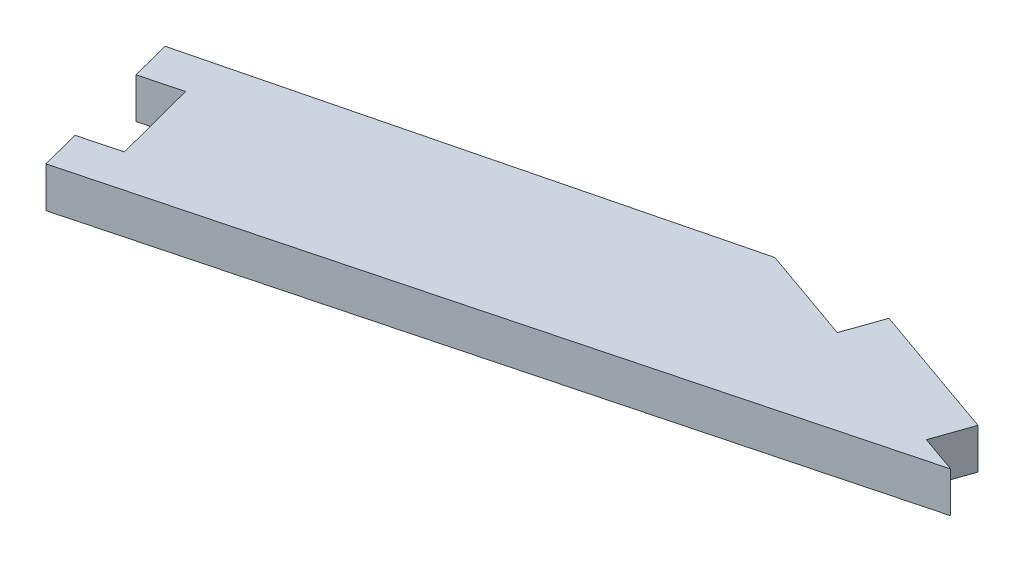
from build123d import *

# Parameters (mm, degrees)
BOSS_EXTRUDE1_DEPTH             = 15
BOSS_EXTRUDE2_REACH             = 1239.023
BOSS_EXTRUDE2_DIRECTION_2_REACH = 1239.023
CUT_EXTRUDE2_DEPTH              = 1238.578280352
CUT_EXTRUDE2_DEPTH_BACK         = 1238.578280352
SKETCH5_W                       = 40
SKETCH5_H                       = 40
CUT_EXTRUDE3_DEPTH              = 1238.578280352
BOSS_EXTRUDE4_DEPTH             = 75
CUT_EXTRUDE4_DEPTH              = 1241.107934819
CUT_EXTRUDE4_DEPTH_BACK         = 1241.107934819
SKETCH8_W                       = 15
SKETCH8_H                       = 73.7
FILLET1_R                       = 5
CUT_EXTRUDE5_DEPTH              = 1241.107934819
CUT_EXTRUDE5_DEPTH_BACK         = 1241.107934819
SKETCH9_W                       = 25
SKETCH9_H                       = 15
SKETCH9_W_2                     = 15
CUT_EXTRUDE6_DEPTH              = 1241.107934819
CUT_EXTRUDE6_DEPTH_BACK         = 1241.107934819
SKETCH10_W                      = 1728.920732784
SKETCH10_H                      = 178.853868908
SKETCH10_W_2                    = 1650
SKETCH10_H_2                    = 15
SKETCH11_W                      = 1852.680615207
SKETCH11_H                      = 1075.927112831
CUT_EXTRUDE7_DEPTH              = 1238.022635201


with BuildPart() as part:
    # Sketch1 → Boss-Extrude1 (new body)
    with BuildSketch(Plane(origin=(0, 0, 0), x_dir=(1, 0, 0), z_dir=(0, 1, 0))):
        Polygon((-450, 300), (-400, 300), (-200, 250), (600, 40), (1200, 40), (1200, -40), (600, -40), (-200, -250), (-400, -300), (-450, -300), align=None)
    extrude(amount=BOSS_EXTRUDE1_DEPTH)

    # Boss-Extrude2: up to this face of the body (flat: up to its plane)
    boss_extrude2_end = Plane(part.part.faces().sort_by_distance((-425, 7.5, 300))[0])
    # Sketch2 → Boss-Extrude2 (add, up to the picked face)
    with BuildSketch(Plane.XY, mode=Mode.PRIVATE) as boss_extrude2_sk1:
        with BuildLine():
            Line((-425, 0), (-450, 0))
            Line((-450, 0), (-450, -40))
            Line((-450, -40), (-440, -40))
            Line((-440, -40), (-440, -15))
            ThreePointArc((-440, -15), (-435.606601718, -4.393398282), (-425, 0))
        make_face()
    boss_extrude2_tool1 = split(extrude(boss_extrude2_sk1.sketch, amount=BOSS_EXTRUDE2_REACH, mode=Mode.PRIVATE), bisect_by=boss_extrude2_end, keep=Keep.BOTH, mode=Mode.PRIVATE)
    # Sketch2 → Boss-Extrude2 (add, up to the picked face)
    with BuildSketch(Plane.XY, mode=Mode.PRIVATE) as boss_extrude2_sk2:
        with BuildLine():
            Line((-400, 0), (-425, 0))
            ThreePointArc((-425, 0), (-414.393398282, -4.393398282), (-410, -15))
            Line((-410, -15), (-410, -40))
            Line((-410, -40), (-400, -40))
            Line((-400, -40), (-400, 0))
        make_face()
    boss_extrude2_tool2 = split(extrude(boss_extrude2_sk2.sketch, amount=BOSS_EXTRUDE2_REACH, mode=Mode.PRIVATE), bisect_by=boss_extrude2_end, keep=Keep.BOTH, mode=Mode.PRIVATE)
    add(boss_extrude2_tool1.solids().sort_by(Axis((-444.100555, -18.206662, 0), (0, 0, 1)))[0])
    add(boss_extrude2_tool2.solids().sort_by(Axis((-405.899445, -18.206662, 0), (0, 0, 1)))[0])

    # Boss-Extrude2 direction 2: up to this face of the body (flat: up to its plane)
    boss_extrude2_direction_2_end = Plane(part.part.faces().sort_by_distance((-425, 7.5, -300))[0])
    # Sketch2 → Boss-Extrude2 direction 2 (add, up to the picked face)
    with BuildSketch(Plane.XY, mode=Mode.PRIVATE) as boss_extrude2_direction_2_sk1:
        with BuildLine():
            Line((-425, 0), (-450, 0))
            Line((-450, 0), (-450, -40))
            Line((-450, -40), (-440, -40))
            Line((-440, -40), (-440, -15))
            ThreePointArc((-440, -15), (-435.606601718, -4.393398282), (-425, 0))
        make_face()
    boss_extrude2_direction_2_tool1 = split(extrude(boss_extrude2_direction_2_sk1.sketch, amount=-BOSS_EXTRUDE2_DIRECTION_2_REACH, mode=Mode.PRIVATE), bisect_by=boss_extrude2_direction_2_end, keep=Keep.BOTH, mode=Mode.PRIVATE)
    # Sketch2 → Boss-Extrude2 direction 2 (add, up to the picked face)
    with BuildSketch(Plane.XY, mode=Mode.PRIVATE) as boss_extrude2_direction_2_sk2:
        with BuildLine():
            Line((-400, 0), (-425, 0))
            ThreePointArc((-425, 0), (-414.393398282, -4.393398282), (-410, -15))
            Line((-410, -15), (-410, -40))
            Line((-410, -40), (-400, -40))
            Line((-400, -40), (-400, 0))
        make_face()
    boss_extrude2_direction_2_tool2 = split(extrude(boss_extrude2_direction_2_sk2.sketch, amount=-BOSS_EXTRUDE2_DIRECTION_2_REACH, mode=Mode.PRIVATE), bisect_by=boss_extrude2_direction_2_end, keep=Keep.BOTH, mode=Mode.PRIVATE)
    add(boss_extrude2_direction_2_tool1.solids().sort_by(Axis((-444.100555, -18.206662, 0), (0, 0, -1)))[0])
    add(boss_extrude2_direction_2_tool2.solids().sort_by(Axis((-405.899445, -18.206662, 0), (0, 0, -1)))[0])

    # Sketch4 → Cut-Extrude2 (cut, two sides: drawn at the far end of the back side and taken through both)
    with BuildSketch(Plane(origin=(0, 0, 0), x_dir=(1, 0, 0), z_dir=(0, 1, 0)).offset(-CUT_EXTRUDE2_DEPTH_BACK)):
        Polygon((-450, 230), (-400, 230), (-150, 167.5), (-150, -167.5), (-400, -230), (-450, -230), align=None)
        Polygon((-100, 155), (-100, -155), (520, 0), align=None)
    extrude(amount=CUT_EXTRUDE2_DEPTH + CUT_EXTRUDE2_DEPTH_BACK, mode=Mode.SUBTRACT)

    # Sketch5 → Cut-Extrude3 (cut, through all)
    with BuildSketch(Plane(origin=(0, 0, 0), x_dir=(0, 0, -1), z_dir=(1, 0, 0))):
        with Locations((-265, -20)):
            Rectangle(SKETCH5_W, SKETCH5_H)
        with Locations((265, -20)):
            Rectangle(SKETCH5_W, SKETCH5_H)
    extrude(amount=-CUT_EXTRUDE3_DEPTH, mode=Mode.SUBTRACT)

    # Sketch7 → Boss-Extrude4 (add)
    with BuildSketch(Plane(origin=(1200, 0, 0), x_dir=(0, 0, -1), z_dir=(1, 0, 0))):
        with BuildLine():
            Line((-87.5, 50), (-40, 15))
            Line((-40, 15), (40, 15))
            Line((40, 15), (87.5, 50))
            Line((87.5, 50), (87.5, 88.7))
            Line((87.5, 88.7), (58.5, 88.7))
            Line((58.5, 88.7), (58.5, 63.2))
            Line((58.5, 63.2), (48.5, 63.2))
            Line((48.5, 63.2), (48.5, 88.7))
            Line((48.5, 88.7), (20, 88.7))
            Line((20, 88.7), (20, 50))
            ThreePointArc((20, 50), (0, 30), (-20, 50))
            Line((-20, 50), (-20, 88.7))
            Line((-20, 88.7), (-63, 88.7))
            Line((-63, 88.7), (-63, 63.2))
            Line((-63, 63.2), (-73, 63.2))
            Line((-73, 63.2), (-73, 88.7))
            Line((-73, 88.7), (-87.5, 88.7))
            Line((-87.5, 88.7), (-87.5, 50))
        make_face()
    extrude(amount=-BOSS_EXTRUDE4_DEPTH)

    # Sketch8 → Cut-Extrude4 (cut, two sides: drawn at the far end of the back side and taken through both)
    with BuildSketch(Plane.XY.offset(-CUT_EXTRUDE4_DEPTH_BACK)):
        with Locations((1147.5, 51.85)):
            Rectangle(SKETCH8_W, SKETCH8_H)
        with Locations((1177.5, 51.85)):
            Rectangle(SKETCH8_W, SKETCH8_H)
    extrude(amount=CUT_EXTRUDE4_DEPTH + CUT_EXTRUDE4_DEPTH_BACK, mode=Mode.SUBTRACT)

    # Fillet1
    fillet1_edges = [part.edges().sort_by_distance(p)[0] for p in [
        (1192.5, 50, 87.5),
        (1162.5, 50, 87.5),
        (1132.5, 50, 87.5),
        (1192.5, 50, -87.5),
        (1162.5, 50, -87.5),
        (1132.5, 50, -87.5),
        (1192.5, 88.7, -87.5),
        (1162.5, 88.7, -87.5),
        (1132.5, 88.7, -87.5),
        (1132.5, 88.7, -58.5),
        (1162.5, 88.7, -58.5),
        (1192.5, 88.7, -58.5),
        (1192.5, 88.7, -48.5),
        (1162.5, 88.7, -48.5),
        (1132.5, 88.7, -48.5),
        (1192.5, 88.7, -20),
        (1162.5, 88.7, -20),
        (1132.5, 88.7, -20),
        (1192.5, 88.7, 63),
        (1162.5, 88.7, 63),
        (1132.5, 88.7, 63),
        (1132.5, 88.7, 87.5),
        (1162.5, 88.7, 87.5),
        (1192.5, 88.7, 87.5),
        (1192.5, 88.7, 73),
        (1162.5, 88.7, 73),
        (1132.5, 88.7, 73),
        (1192.5, 88.7, 20),
        (1162.5, 88.7, 20),
        (1132.5, 88.7, 20),
        (600, 7.5, 40),
        (600, 7.5, -40),
        (520, 7.5, 0),
        (-440, -40, -292.5),
        (-440, -40, -237.5),
        (-400, -40, -292.5),
        (-400, -40, -237.5),
        (-450, -40, -237.5),
        (-410, -40, -237.5),
        (-450, -40, -292.5),
        (-410, -40, -292.5),
        (-150, 7.5, 167.5),
        (-100, 7.5, 155),
        (-150, 7.5, -167.5),
        (-100, 7.5, -155),
        (-450, -40, 237.5),
        (-410, -40, 237.5),
        (-440, -40, 237.5),
        (-400, -40, 237.5),
        (-450, -40, 292.5),
        (-440, -40, 292.5),
        (-400, -40, 292.5),
        (-410, -40, 292.5),
    ]]
    fillet(fillet1_edges, radius=FILLET1_R - 0.0001)  # a hair under: the kernel refuses the full size

    # Sketch9 → Cut-Extrude5 (cut, two sides: drawn at the far end of the back side and taken through both)
    with BuildSketch(Plane(origin=(0, 0, 0), x_dir=(1, 0, 0), z_dir=(0, 1, 0)).offset(-CUT_EXTRUDE5_DEPTH_BACK)):
        with Locations((-425, -292.5)):
            Rectangle(SKETCH9_W, SKETCH9_H)
        with Locations((1192.5, -32.5)):
            Rectangle(SKETCH9_W_2, SKETCH9_H)
        with Locations((1192.5, 32.5)):
            Rectangle(SKETCH9_W_2, SKETCH9_H)
        with Locations((1162.5, 32.5)):
            Rectangle(SKETCH9_W_2, SKETCH9_H)
        with Locations((1132.5, 32.5)):
            Rectangle(SKETCH9_W_2, SKETCH9_H)
        with Locations((1132.5, -32.5)):
            Rectangle(SKETCH9_W_2, SKETCH9_H)
        with Locations((1162.5, -32.5)):
            Rectangle(SKETCH9_W_2, SKETCH9_H)
        with Locations((-425, -237.5)):
            Rectangle(SKETCH9_W, SKETCH9_H)
        with Locations((-425, 237.5)):
            Rectangle(SKETCH9_W, SKETCH9_H)
        with Locations((-425, 292.5)):
            Rectangle(SKETCH9_W, SKETCH9_H)
    extrude(amount=CUT_EXTRUDE5_DEPTH + CUT_EXTRUDE5_DEPTH_BACK, mode=Mode.SUBTRACT)


with BuildPart() as cut_extrude5_piece_1:
    # of the separate pieces the step leaves, piece 1, a body of its own (cut_extrude5_pieces)
    add(part.part.solids().sort_by_distance((-400, -35.0001, -300))[0])


with BuildPart() as cut_extrude5_piece_2:
    # of the separate pieces the step leaves, piece 2, a body of its own (cut_extrude5_pieces)
    add(part.part.solids().sort_by_distance((1170, 48.501289589, 85.46603587))[0])


with BuildPart() as cut_extrude5_piece_3:
    # of the separate pieces the step leaves, piece 3, a body of its own (cut_extrude5_pieces)
    add(part.part.solids().sort_by_distance((1170, 48.501289589, -85.46603587))[0])


with BuildPart() as cut_extrude5_piece_4:
    # of the separate pieces the step leaves, piece 4, a body of its own (cut_extrude5_pieces)
    add(part.part.solids().sort_by_distance((1125, 83.7001, 73))[0])


with BuildPart() as cut_extrude5_piece_5:
    # of the separate pieces the step leaves, piece 5, a body of its own (cut_extrude5_pieces)
    add(part.part.solids().sort_by_distance((1200, 48.501289589, 85.46603587))[0])


with BuildPart() as cut_extrude5_piece_6:
    # of the separate pieces the step leaves, piece 6, a body of its own (cut_extrude5_pieces)
    add(part.part.solids().sort_by_distance((1200, 48.501289589, -85.46603587))[0])


with BuildPart() as cut_extrude5_piece_7:
    # of the separate pieces the step leaves, piece 7, a body of its own (cut_extrude5_pieces)
    add(part.part.solids().sort_by_distance((1125, 88.7, -40))[0])


with BuildPart() as cut_extrude6_tool:
    # Sketch10 → Cut-Extrude6 (new, two sides: drawn at the far end of the back side and taken through both)
    with BuildSketch(Plane.XY.offset(-CUT_EXTRUDE6_DEPTH_BACK)):
        with Locations((378.379601058, 20.599691165)):
            Rectangle(SKETCH10_W, SKETCH10_H)
        with Locations((375, 7.5)):
            Rectangle(SKETCH10_W_2, SKETCH10_H_2, mode=Mode.SUBTRACT)
    extrude(amount=CUT_EXTRUDE6_DEPTH + CUT_EXTRUDE6_DEPTH_BACK)


with BuildPart() as cut_extrude5_piece_1_1:
    add(cut_extrude5_piece_1.part)

    # Cut-Extrude6: cut by cut_extrude6_tool
    add(cut_extrude6_tool.part, mode=Mode.SUBTRACT)

    # Sketch11 → Cut-Extrude7 (cut, through all)
    # profile 1 of 8: a face of its own
    with BuildSketch(Plane(origin=(0, 0, 0), x_dir=(1, 0, 0), z_dir=(0, 1, 0))):
        with Locations((324.970767393, -26.108881651)):
            Rectangle(SKETCH11_W, SKETCH11_H)
        Polygon((309.276307823, -116.314969197), (-450, -315.625), (-450, -242.5), (-450, -230), (-400, -230), (-150, -167.5), (-135, -163.75), (-115, -158.75), (-100, -155), (293.601058917, -56.599735271), (308.154197556, -52.961450611), (474.15750273, -11.460624318), (500.597149997, -4.850712501), (514.749174704, -9.82265344), (565.538165046, -27.666026778), (600.645318554, -40), (574.718248814, -46.789992423), (323.784772304, -112.50649727), align=None, mode=Mode.SUBTRACT)
    # profile 2 of 8: a face of its own
    with BuildSketch(Plane(origin=(0, 0, 0), x_dir=(1, 0, 0), z_dir=(0, 1, 0))):
        Polygon((-450, -230), (-450, -242.5), (-400, -230), align=None)
    # profile 3 of 8: a face of its own
    with BuildSketch(Plane(origin=(0, 0, 0), x_dir=(1, 0, 0), z_dir=(0, 1, 0))):
        Polygon((-450, -242.5), (-450, -315.625), (309.276307823, -116.314969197), (305.467835897, -101.806504716), (297.409530844, -71.108199751), (293.601058917, -56.599735271), (-100, -155), (-100, -182.5), (-115, -182.5), (-115, -158.75), (-135, -163.75), (-135, -182.5), (-150, -182.5), (-150, -167.5), (-400, -230), align=None)
    # profile 4 of 8: a face of its own
    with BuildSketch(Plane(origin=(0, 0, 0), x_dir=(1, 0, 0), z_dir=(0, 1, 0))):
        Polygon((-135, -163.75), (-150, -167.5), (-150, -182.5), (-135, -182.5), align=None)
    # profile 5 of 8: a face of its own
    with BuildSketch(Plane(origin=(0, 0, 0), x_dir=(1, 0, 0), z_dir=(0, 1, 0))):
        Polygon((-100, -182.5), (-100, -155), (-115, -158.75), (-115, -182.5), align=None)
    # profile 6 of 8: a face of its own
    with BuildSketch(Plane(origin=(0, 0, 0), x_dir=(1, 0, 0), z_dir=(0, 1, 0))):
        Polygon((560.566224107, -41.818051484), (574.718248814, -46.789992423), (600.645318554, -40), (565.538165046, -27.666026778), align=None)
    # profile 7 of 8: a face of its own
    with BuildSketch(Plane(origin=(0, 0, 0), x_dir=(1, 0, 0), z_dir=(0, 1, 0))):
        Polygon((474.15750273, -11.460624318), (509.777233765, -23.974678146), (514.749174704, -9.82265344), (500.597149997, -4.850712501), align=None)
    # profile 8 of 8: a face of its own
    with BuildSketch(Plane(origin=(0, 0, 0), x_dir=(1, 0, 0), z_dir=(0, 1, 0))):
        Polygon((297.409530844, -71.108199751), (305.467835897, -101.806504716), (319.976300377, -97.99803279), (311.917995324, -67.299727825), align=None)
    extrude(amount=CUT_EXTRUDE7_DEPTH, mode=Mode.SUBTRACT)


with BuildPart() as cut_extrude5_piece_2_1:
    add(cut_extrude5_piece_2.part)

    # Cut-Extrude6: cut by cut_extrude6_tool
    add(cut_extrude6_tool.part, mode=Mode.SUBTRACT)


with BuildPart() as cut_extrude5_piece_3_1:
    add(cut_extrude5_piece_3.part)

    # Cut-Extrude6: cut by cut_extrude6_tool
    add(cut_extrude6_tool.part, mode=Mode.SUBTRACT)


with BuildPart() as cut_extrude5_piece_4_1:
    add(cut_extrude5_piece_4.part)

    # Cut-Extrude6: cut by cut_extrude6_tool
    add(cut_extrude6_tool.part, mode=Mode.SUBTRACT)


with BuildPart() as cut_extrude5_piece_5_1:
    add(cut_extrude5_piece_5.part)

    # Cut-Extrude6: cut by cut_extrude6_tool
    add(cut_extrude6_tool.part, mode=Mode.SUBTRACT)


with BuildPart() as cut_extrude5_piece_6_1:
    add(cut_extrude5_piece_6.part)

    # Cut-Extrude6: cut by cut_extrude6_tool
    add(cut_extrude6_tool.part, mode=Mode.SUBTRACT)


with BuildPart() as cut_extrude5_piece_7_1:
    add(cut_extrude5_piece_7.part)

    # Cut-Extrude6: cut by cut_extrude6_tool
    add(cut_extrude6_tool.part, mode=Mode.SUBTRACT)


solid = cut_extrude5_piece_1_1.part
